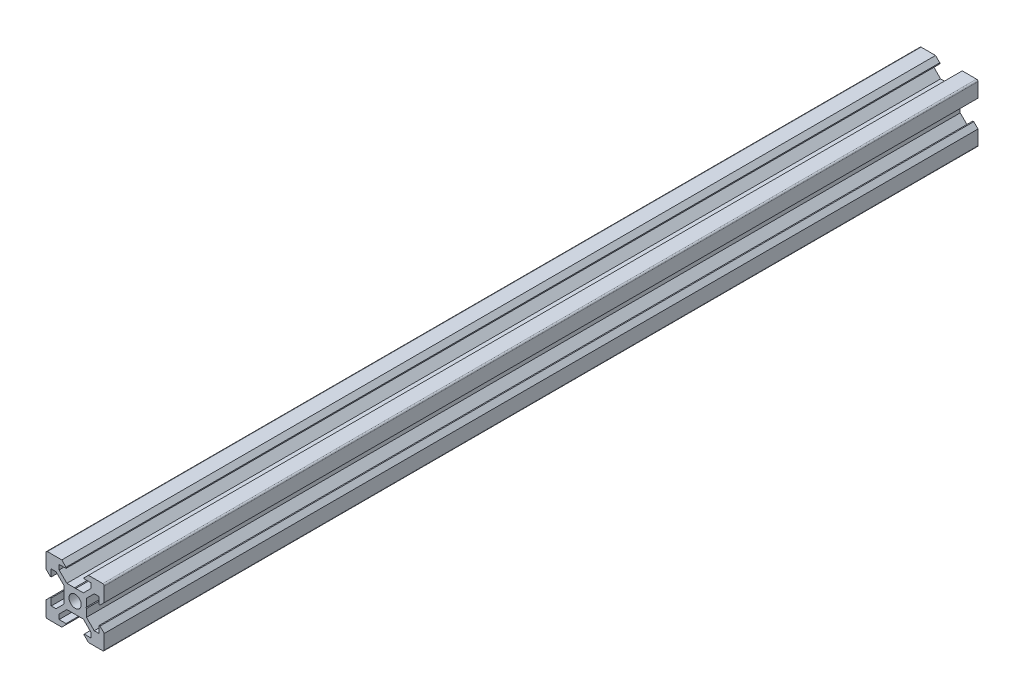
from build123d import *

# Parameters (mm, degrees)
SKETCH1_R           = 2.1
BOSS_EXTRUDE1_DEPTH = 150


with BuildPart() as part:
    # Sketch1 → Boss-Extrude1 (new, symmetric)
    with BuildSketch(Plane.XY):
        with BuildLine():
            Line((4.58, -10), (9.5, -10))
            ThreePointArc((9.5, -10), (9.853553391, -9.853553391), (10, -9.5))
            Line((10, -9.5), (10, -4.58))
            Line((10, -4.58), (8.545, -3.125))
            Line((8.545, -3.125), (8.2, -3.125))
            Line((8.2, -3.125), (8.2, -5.5))
            Line((8.2, -5.5), (6.560660172, -5.5))
            Line((6.560660172, -5.5), (3.9, -2.839339828))
            Line((3.9, -2.839339828), (3.9, -0.21))
            Line((3.9, -0.21), (3.69, 0))
            Line((3.69, 0), (3.9, 0.21))
            Line((3.9, 0.21), (3.9, 2.839339828))
            Line((3.9, 2.839339828), (6.560660172, 5.5))
            Line((6.560660172, 5.5), (8.2, 5.5))
            Line((8.2, 5.5), (8.2, 3.125))
            Line((8.2, 3.125), (8.545, 3.125))
            Line((8.545, 3.125), (10, 4.58))
            Line((10, 4.58), (10, 9.5))
            ThreePointArc((10, 9.5), (9.853553391, 9.853553391), (9.5, 10))
            Line((9.5, 10), (4.58, 10))
            Line((4.58, 10), (3.125, 8.545))
            Line((3.125, 8.545), (3.125, 8.2))
            Line((3.125, 8.2), (5.5, 8.2))
            Line((5.5, 8.2), (5.5, 6.560660172))
            Line((5.5, 6.560660172), (2.839339828, 3.9))
            Line((2.839339828, 3.9), (0.21, 3.9))
            Line((0.21, 3.9), (0, 3.69))
            Line((0, 3.69), (-0.21, 3.9))
            Line((-0.21, 3.9), (-2.839339828, 3.9))
            Line((-2.839339828, 3.9), (-5.5, 6.560660172))
            Line((-5.5, 6.560660172), (-5.5, 8.2))
            Line((-5.5, 8.2), (-3.125, 8.2))
            Line((-3.125, 8.2), (-3.125, 8.545))
            Line((-3.125, 8.545), (-4.58, 10))
            Line((-4.58, 10), (-9.5, 10))
            ThreePointArc((-9.5, 10), (-9.853553391, 9.853553391), (-10, 9.5))
            Line((-10, 9.5), (-10, 4.58))
            Line((-10, 4.58), (-8.545, 3.125))
            Line((-8.545, 3.125), (-8.2, 3.125))
            Line((-8.2, 3.125), (-8.2, 5.5))
            Line((-8.2, 5.5), (-6.560660172, 5.5))
            Line((-6.560660172, 5.5), (-3.9, 2.839339828))
            Line((-3.9, 2.839339828), (-3.9, 0.21))
            Line((-3.9, 0.21), (-3.69, 0))
            Line((-3.69, 0), (-3.9, -0.21))
            Line((-3.9, -0.21), (-3.9, -2.839339828))
            Line((-3.9, -2.839339828), (-6.560660172, -5.5))
            Line((-6.560660172, -5.5), (-8.2, -5.5))
            Line((-8.2, -5.5), (-8.2, -3.125))
            Line((-8.2, -3.125), (-8.545, -3.125))
            Line((-8.545, -3.125), (-10, -4.58))
            Line((-10, -4.58), (-10, -9.5))
            ThreePointArc((-10, -9.5), (-9.853553391, -9.853553391), (-9.5, -10))
            Line((-9.5, -10), (-4.58, -10))
            Line((-4.58, -10), (-3.125, -8.545))
            Line((-3.125, -8.545), (-3.125, -8.2))
            Line((-3.125, -8.2), (-5.5, -8.2))
            Line((-5.5, -8.2), (-5.5, -6.560660172))
            Line((-5.5, -6.560660172), (-2.839339828, -3.9))
            Line((-2.839339828, -3.9), (-0.21, -3.9))
            Line((-0.21, -3.9), (0, -3.69))
            Line((0, -3.69), (0.21, -3.9))
            Line((0.21, -3.9), (2.839339828, -3.9))
            Line((2.839339828, -3.9), (5.5, -6.560660172))
            Line((5.5, -6.560660172), (5.5, -8.2))
            Line((5.5, -8.2), (3.125, -8.2))
            Line((3.125, -8.2), (3.125, -8.545))
            Line((3.125, -8.545), (4.58, -10))
        make_face()
        Circle(SKETCH1_R, mode=Mode.SUBTRACT)
    extrude(amount=BOSS_EXTRUDE1_DEPTH, both=True)


solid = part.part
